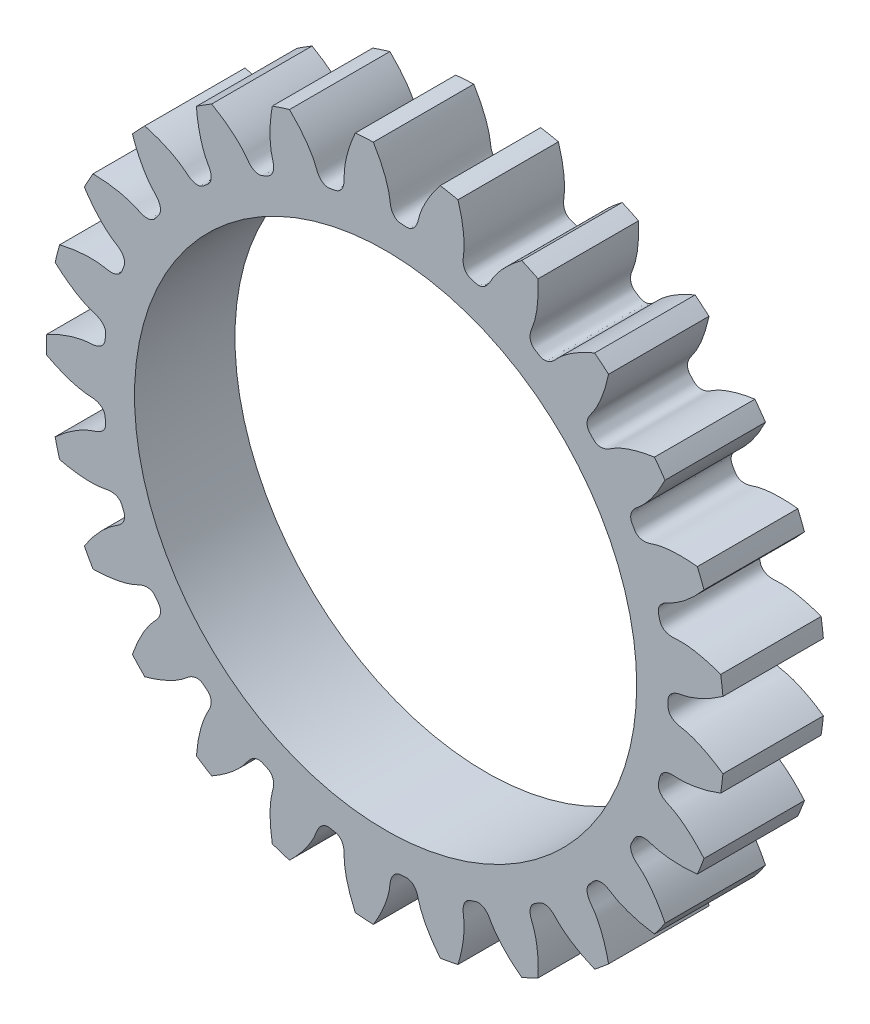
from build123d import *

# Parameters (mm, degrees)
SKETCHREVOLVESPURGEAR_W       = 4
SKETCHREVOLVESPURGEAR_H       = 13.499999797
TOOTHEXTRUDECUTSPURGEAR_DEPTH = 2
PATTERNSPURGEAR_COUNT         = 25
BOREREVOLVESKETCH_W           = 4
BOREREVOLVESKETCH_H           = 10


with BuildPart() as part:
    # SketchRevolveSpurGear → SpurGear (revolve)
    with BuildSketch(Plane(origin=(0, 0, 0), x_dir=(0, 0, -1), z_dir=(1, 0, 0))):
        with Locations((0, 6.749999899)):
            Rectangle(SKETCHREVOLVESPURGEAR_W, SKETCHREVOLVESPURGEAR_H)
    revolve(axis=Axis((0, 0, 0), (0, 0, -1)))

    # SketchToothSpurGear → ToothExtrudeCutSpurGear (cut, symmetric)
    with BuildSketch(Plane.XY):
        with BuildLine():
            ThreePointArc((13.48079108, 1.367759604), (13.549999796, 0), (13.48079108, -1.367759604))
            add(Edge.make_bspline(
                [(13.48079108, -1.367759604), (13.380886834, -1.295987874), (13.232111933, -1.195117759), (13.033570765, -1.072970681), (12.894717782, -0.992950623), (12.762174891, -0.921557624), (12.636316285, -0.85835904), (12.517496388, -0.802907872), (12.406049342, -0.75474374), (12.302288567, -0.713393758), (12.20650621, -0.678372927), (12.118973088, -0.649186384), (12.039937172, -0.625325697), (11.969626801, -0.60628406), (11.908239368, -0.591512943), (11.799361551, -0.568687216), (11.691684335, -0.553914245), (11.589099942, -0.520212032), (11.539861695, -0.500727816), (11.492227702, -0.477683361), (11.445783157, -0.450190162), (11.400255173, -0.416738633), (11.355834612, -0.37518973), (11.313911201, -0.322840458), (11.277847478, -0.257347808), (11.255667922, -0.183755112), (11.24675293, -0.096245993), (11.251950461, 0), (11.24675293, 0.096245993), (11.255667922, 0.183755112), (11.277847478, 0.257347808), (11.313911201, 0.322840458), (11.355834612, 0.37518973), (11.400255173, 0.416738633), (11.445783157, 0.450190162), (11.492227702, 0.477683361), (11.539861695, 0.500727816), (11.589099942, 0.520212032), (11.691684335, 0.553914245), (11.799361551, 0.568687216), (11.908239368, 0.591512943), (11.969626801, 0.60628406), (12.039937172, 0.625325697), (12.118973088, 0.649186384), (12.20650621, 0.678372927), (12.302288567, 0.713393758), (12.406049342, 0.75474374), (12.517496388, 0.802907872), (12.636316285, 0.85835904), (12.762174891, 0.921557624), (12.894717782, 0.992950623), (13.033570765, 1.072970681), (13.232111933, 1.195117759), (13.380886834, 1.295987874), (13.48079108, 1.367759604)],
                knots=[0, 0, 0, 0, 0.066628363, 0.097312478, 0.126243214, 0.153420573, 0.178844554, 0.202515157, 0.224432382, 0.244596229, 0.263006698, 0.279663789, 0.294567502, 0.307717838, 0.319114795, 0.328758375, 0.367985616, 0.377666442, 0.387173495, 0.396651881, 0.406296908, 0.416367886, 0.427194119, 0.439149378, 0.452549791, 0.467442003, 0.480440239, 0.5, 0.519559761, 0.532557997, 0.547450209, 0.560850622, 0.572805881, 0.583632114, 0.593703092, 0.603348119, 0.612826505, 0.622333558, 0.632014384, 0.671241625, 0.680885205, 0.692282162, 0.705432498, 0.720336211, 0.736993302, 0.755403771, 0.775567618, 0.797484843, 0.821155446, 0.846579427, 0.873756786, 0.902687522, 0.933371637, 1, 1, 1, 1], degree=3))
        make_face()
    toothextrudecutspurgear = extrude(amount=TOOTHEXTRUDECUTSPURGEAR_DEPTH, both=True, mode=Mode.SUBTRACT)

    # PatternSpurGear: ToothExtrudeCutSpurGear ×25 about axis
    patternspurgear_axis = Axis((0, 0, 55), (0, 0, -1))
    for i in range(1, PATTERNSPURGEAR_COUNT):
        add(toothextrudecutspurgear.rotate(patternspurgear_axis, i * 360 / PATTERNSPURGEAR_COUNT), mode=Mode.SUBTRACT)

    # BoreRevolveSketch → BoreRevolveCut (revolve, cut)
    with BuildSketch(Plane(origin=(0, 0, 0), x_dir=(0, 0, -1), z_dir=(1, 0, 0))):
        with Locations((0, 5)):
            Rectangle(BOREREVOLVESKETCH_W, BOREREVOLVESKETCH_H)
    revolve(axis=Axis((0, 0, 0), (0, 0, -1)), mode=Mode.SUBTRACT)


solid = part.part
